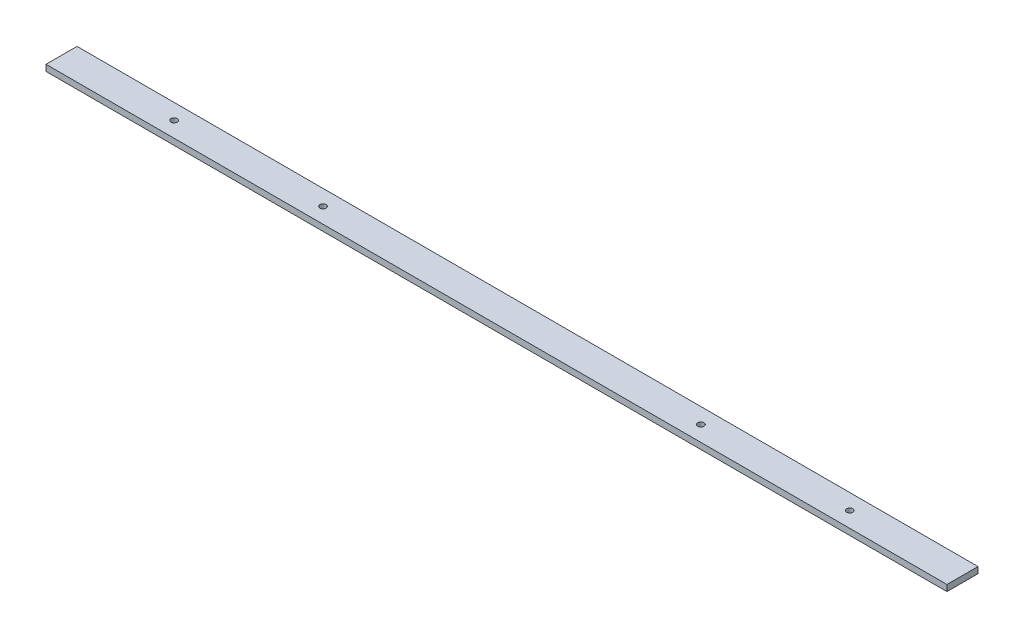
from build123d import *

# Parameters (mm, degrees)
SKETCH1_W          = 290.35
SKETCH1_H          = 10
BASE_FLANGE1_DEPTH = 2
SKETCH2_R          = 1
CUT_EXTRUDE1_DEPTH = 10


# Sheet-metal steps are written as plain solids
with BuildPart() as part:
    # Sketch1 → Base-Flange1 (new body)
    with BuildSketch(Plane(origin=(0, 0, 0), x_dir=(1, 0, 0), z_dir=(0, 1, 0))):
        with Locations((99.408746863, -5)):
            Rectangle(SKETCH1_W, SKETCH1_H)
    extrude(amount=-BASE_FLANGE1_DEPTH)

    # Sketch2 → Cut-Extrude1 (cut)
    with BuildSketch(Plane(origin=(0, 0, 0), x_dir=(1, 0, 0), z_dir=(0, 1, 0))):
        with Locations(Location((-9.471253137, -5, 0), (0, 0, 270))):
            Circle(SKETCH2_R)
        with Locations(Location((38.528746863, -5, 0), (0, 0, 270))):
            Circle(SKETCH2_R)
        with Locations(Location((160.288746863, -5, 0), (0, 0, 270))):
            Circle(SKETCH2_R)
        with Locations(Location((208.288746863, -5, 0), (0, 0, 270))):
            Circle(SKETCH2_R)
    extrude(amount=-CUT_EXTRUDE1_DEPTH, mode=Mode.SUBTRACT)


solid = part.part
